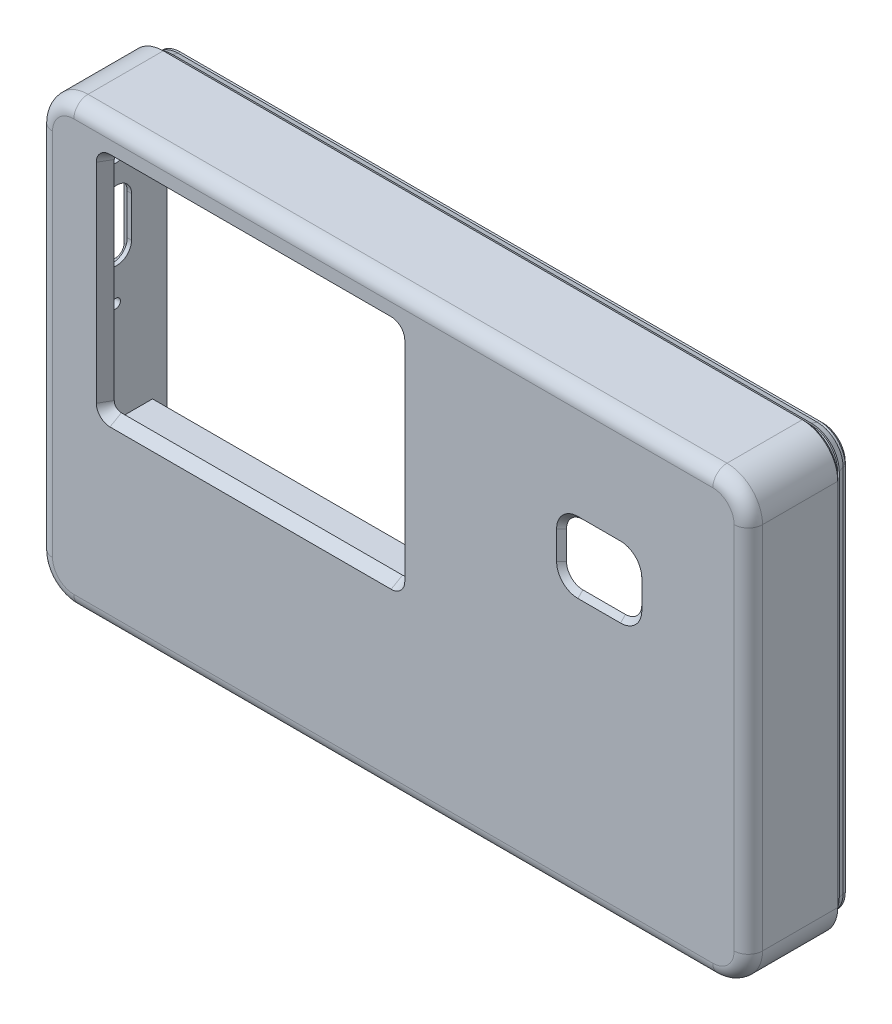
from build123d import *

# Parameters (mm, degrees)
BODY_DEPTH              = 13
ROUND_FRONT_R           = 2
CAVITY_DEPTH            = 11.4
LIP_START               = -2.5
LIP_DEPTH               = 2.5
LIP_CHAMFER_SIZE        = 0.5
BEAD_DEPTH              = 0.8
BEAD_DRAFT              = -17.354024636
SCREEN_WINDOW_DEPTH     = 1.9
SCREEN_WINDOW_DRAFT     = -30
BOARD_FENCE_SK6_W       = 1.2
BOARD_FENCE_SK6_H       = 31.02
BOARD_FENCE_SK6_W_2     = 42.22
BOARD_FENCE_SK6_H_2     = 1.2
BOARD_FENCE_DEPTH       = 5.9
TP_RAILS_SK7_W          = 25
TP_RAILS_SK7_H          = 1.2
TP_RAILS_DEPTH          = 1.57
TP_FENCE_SK8_W          = 24
TP_FENCE_SK8_H          = 1
TP_FENCE_SK8_W_2        = 1
TP_FENCE_SK8_H_2        = 15.3
TP_FENCE_SK8_H_3        = 1.05
TP_FENCE_DEPTH          = 3.37
CELL_RIBS_SK9_W         = 1.2
CELL_RIBS_SK9_H         = 12
CELL_RIBS_DEPTH         = 9.05
MAX_RELIEF_DEPTH        = 0.9
MAX_WINDOW_DEPTH        = 1.8
MAX_WINDOW_CHAMFER_SIZE = 1
MAX_LEDGES_SK12_W       = 1.6
MAX_LEDGES_SK12_H       = 1.6
MAX_LEDGES_DEPTH        = 1.3
MAX_FENCE_DEPTH         = 2.6
USB_RECESS_DEPTH        = 2
LEFT_PORTS_SK15_R       = 1.8
LEFT_PORTS_SK15_R_2     = 0.65
LEFT_PORTS_DEPTH        = 3.2
BUZZER_KEEPER_SK16_W    = 1.2
BUZZER_KEEPER_SK16_H    = 8
BUZZER_KEEPER_DEPTH     = 14.8
MIC_KEEPER_SK17_W       = 6
MIC_KEEPER_SK17_H       = 1.2
MIC_KEEPER_DEPTH        = 13.5
SEAM_SHADOW_SIZE        = 0.4
PRY_NOTCH_SK18_W        = 8
PRY_NOTCH_SK18_H        = 1.8
PRY_NOTCH_DEPTH         = 1.2


with BuildPart() as part:
    # Body_Sk1 → Body (new body)
    with BuildSketch(Plane.XY):
        with BuildLine():
            Line((-45, -31), (45, -31))
            ThreePointArc((45, -31), (48.535533906, -29.535533906), (50, -26))
            Line((50, -26), (50, 26))
            ThreePointArc((50, 26), (48.535533906, 29.535533906), (45, 31))
            Line((45, 31), (-45, 31))
            ThreePointArc((-45, 31), (-48.535533906, 29.535533906), (-50, 26))
            Line((-50, 26), (-50, -26))
            ThreePointArc((-50, -26), (-48.535533906, -29.535533906), (-45, -31))
        make_face()
    extrude(amount=-BODY_DEPTH)

    # Round_Front
    round_front_edges = [part.edges().sort_by_distance(p)[0] for p in [
        (50, 0, 0),
        (48.535533906, -29.535533906, 0),
        (0, -31, 0),
        (-48.535533906, -29.535533906, 0),
        (-50, 0, 0),
        (-48.535533906, 29.535533906, 0),
        (0, 31, 0),
        (48.535533906, 29.535533906, 0),
    ]]
    fillet(round_front_edges, radius=ROUND_FRONT_R)

    # Cavity_Sk2 → Cavity (cut)
    with BuildSketch(Plane.XY.offset(-13)):
        with BuildLine():
            Line((-45, -28.4), (45, -28.4))
            ThreePointArc((45, -28.4), (46.697056275, -27.697056275), (47.4, -26))
            Line((47.4, -26), (47.4, 26))
            ThreePointArc((47.4, 26), (46.697056275, 27.697056275), (45, 28.4))
            Line((45, 28.4), (-45, 28.4))
            ThreePointArc((-45, 28.4), (-46.697056275, 27.697056275), (-47.4, 26))
            Line((-47.4, 26), (-47.4, -26))
            ThreePointArc((-47.4, -26), (-46.697056275, -27.697056275), (-45, -28.4))
        make_face()
    extrude(amount=CAVITY_DEPTH, mode=Mode.SUBTRACT)

    # Lip_Sk3 → Lip (add)
    with BuildSketch(Plane.XY.offset(-13).offset(LIP_START)):
        with BuildLine():
            Line((-45, -29.66), (45, -29.66))
            ThreePointArc((45, -29.66), (47.588010819, -28.588010819), (48.66, -26))
            Line((48.66, -26), (48.66, 26))
            ThreePointArc((48.66, 26), (47.588010819, 28.588010819), (45, 29.66))
            Line((45, 29.66), (-45, 29.66))
            ThreePointArc((-45, 29.66), (-47.588010819, 28.588010819), (-48.66, 26))
            Line((-48.66, 26), (-48.66, -26))
            ThreePointArc((-48.66, -26), (-47.588010819, -28.588010819), (-45, -29.66))
        make_face()
        with BuildLine():
            Line((-45, -28.4), (45, -28.4))
            ThreePointArc((45, -28.4), (46.697056275, -27.697056275), (47.4, -26))
            Line((47.4, -26), (47.4, 26))
            ThreePointArc((47.4, 26), (46.697056275, 27.697056275), (45, 28.4))
            Line((45, 28.4), (-45, 28.4))
            ThreePointArc((-45, 28.4), (-46.697056275, 27.697056275), (-47.4, 26))
            Line((-47.4, 26), (-47.4, -26))
            ThreePointArc((-47.4, -26), (-46.697056275, -27.697056275), (-45, -28.4))
        make_face(mode=Mode.SUBTRACT)
    extrude(amount=LIP_DEPTH)

    # Lip_Chamfer
    lip_chamfer_edges = [part.edges().sort_by_distance(p)[0] for p in [
        (-47.588010819, -28.588010819, -15.5),
        (-48.66, 0, -15.5),
        (-47.588010819, 28.588010819, -15.5),
        (0, 29.66, -15.5),
        (47.588010819, 28.588010819, -15.5),
        (48.66, 0, -15.5),
        (47.588010819, -28.588010819, -15.5),
        (0, -29.66, -15.5),
    ]]
    chamfer(lip_chamfer_edges, length=LIP_CHAMFER_SIZE)


with BuildPart() as bead_tool:
    # Bead_Sk4 → Bead (with draft: the straight prism first)
    with BuildSketch(Plane.XY.offset(-13.9)):
        with BuildLine():
            Line((-45, -29.91), (45, -29.91))
            ThreePointArc((45, -29.91), (47.764787514, -28.764787514), (48.91, -26))
            Line((48.91, -26), (48.91, 26))
            ThreePointArc((48.91, 26), (47.764787514, 28.764787514), (45, 29.91))
            Line((45, 29.91), (-45, 29.91))
            ThreePointArc((-45, 29.91), (-47.764787514, 28.764787514), (-48.91, 26))
            Line((-48.91, 26), (-48.91, -26))
            ThreePointArc((-48.91, -26), (-47.764787514, -28.764787514), (-45, -29.91))
        make_face()
        with BuildLine():
            Line((-45, -29.06), (45, -29.06))
            ThreePointArc((45, -29.06), (47.16374675, -28.16374675), (48.06, -26))
            Line((48.06, -26), (48.06, 26))
            ThreePointArc((48.06, 26), (47.16374675, 28.16374675), (45, 29.06))
            Line((45, 29.06), (-45, 29.06))
            ThreePointArc((-45, 29.06), (-47.16374675, 28.16374675), (-48.06, 26))
            Line((-48.06, 26), (-48.06, -26))
            ThreePointArc((-48.06, -26), (-47.16374675, -28.16374675), (-45, -29.06))
        make_face(mode=Mode.SUBTRACT)
    extrude(amount=-BEAD_DEPTH)
    # Bead: the draft: its side faces are tilted about the plane it starts from
    bead_sides = [bead_tool.faces().sort_by_distance(p)[0] for p in [
        (0, -29.91, -14.3),
        (47.764787514, -28.764787514, -14.3),
        (48.91, 0, -14.3),
        (47.764787514, 28.764787514, -14.3),
        (0, 29.91, -14.3),
        (-47.764787514, 28.764787514, -14.3),
        (-48.91, 0, -14.3),
        (-47.764787514, -28.764787514, -14.3),
        (-47.16374675, -28.16374675, -14.3),
        (-48.06, 0, -14.3),
        (-47.16374675, 28.16374675, -14.3),
        (0, 29.06, -14.3),
        (47.16374675, 28.16374675, -14.3),
        (48.06, 0, -14.3),
        (47.16374675, -28.16374675, -14.3),
        (0, -29.06, -14.3),
    ]]
    draft(bead_sides, Plane.XY.offset(-13.9), BEAD_DRAFT)


with BuildPart() as part_1:
    add(part.part)

    # Bead: add bead_tool
    add(bead_tool.part)


with BuildPart() as screen_window_tool:
    # Screen_Window_Sk5 → Screen_Window (with draft: the straight prism first)
    with BuildSketch(Plane.XY):
        with BuildLine():
            Line((-39.91, -6.033760431), (-0.31, -6.033760431))
            ThreePointArc((-0.31, -6.033760431), (1.050304046, -5.470304046), (1.613760431, -4.11))
            Line((1.613760431, -4.11), (1.613760431, 25.29))
            ThreePointArc((1.613760431, 25.29), (1.050304046, 26.650304046), (-0.31, 27.213760431))
            Line((-0.31, 27.213760431), (-39.91, 27.213760431))
            ThreePointArc((-39.91, 27.213760431), (-41.270304046, 26.650304046), (-41.833760431, 25.29))
            Line((-41.833760431, 25.29), (-41.833760431, -4.11))
            ThreePointArc((-41.833760431, -4.11), (-41.270304046, -5.470304046), (-39.91, -6.033760431))
        make_face()
    extrude(amount=-SCREEN_WINDOW_DEPTH)
    # Screen_Window: the draft: its side faces are tilted about the plane it starts from
    screen_window_sides = [screen_window_tool.faces().sort_by_distance(p)[0] for p in [
        (-20.11, -6.033760431, -0.95),
        (1.050304046, -5.470304046, -0.95),
        (1.613760431, 10.59, -0.95),
        (1.050304046, 26.650304046, -0.95),
        (-20.11, 27.213760431, -0.95),
        (-41.270304046, 26.650304046, -0.95),
        (-41.833760431, 10.59, -0.95),
        (-41.270304046, -5.470304046, -0.95),
    ]]
    draft(screen_window_sides, Plane.XY, SCREEN_WINDOW_DRAFT)


with BuildPart() as part_2:
    add(part_1.part)

    # Screen_Window: cut by screen_window_tool
    add(screen_window_tool.part, mode=Mode.SUBTRACT)

    # Board_Fence_Sk6 → Board_Fence (add)
    with BuildSketch(Plane.XY.offset(-1.6)):
        with Locations((3.1, 11.59)):
            Rectangle(BOARD_FENCE_SK6_W, BOARD_FENCE_SK6_H)
        with Locations((-20.31, -7.72)):
            Rectangle(BOARD_FENCE_SK6_W_2, BOARD_FENCE_SK6_H_2)
    extrude(amount=-BOARD_FENCE_DEPTH)

    # TP_Rails_Sk7 → TP_Rails (add)
    with BuildSketch(Plane.XY.offset(-1.6)):
        with Locations((-33.2, -26.2)):
            Rectangle(TP_RAILS_SK7_W, TP_RAILS_SK7_H)
        with Locations((-33.2, -10.9)):
            Rectangle(TP_RAILS_SK7_W, TP_RAILS_SK7_H)
    extrude(amount=-TP_RAILS_DEPTH)

    # TP_Fence_Sk8 → TP_Fence (add)
    with BuildSketch(Plane.XY.offset(-1.6)):
        with Locations((-31.2, -9.25)):
            Rectangle(TP_FENCE_SK8_W, TP_FENCE_SK8_H)
        with Locations((-18.4, -18.55)):
            Rectangle(TP_FENCE_SK8_W_2, TP_FENCE_SK8_H_2)
        with Locations((-31.2, -27.875)):
            Rectangle(TP_FENCE_SK8_W, TP_FENCE_SK8_H_3)
    extrude(amount=-TP_FENCE_DEPTH)

    # Cell_Ribs_Sk9 → Cell_Ribs (add)
    with BuildSketch(Plane.XY.offset(-1.6)):
        with Locations((-10, -18.05)):
            Rectangle(CELL_RIBS_SK9_W, CELL_RIBS_SK9_H)
        with Locations((8, -18.05)):
            Rectangle(CELL_RIBS_SK9_W, CELL_RIBS_SK9_H)
        with Locations((22, -18.05)):
            Rectangle(CELL_RIBS_SK9_W, CELL_RIBS_SK9_H)
    extrude(amount=-CELL_RIBS_DEPTH)

    # MAX_Relief_Sk10 → MAX_Relief (cut)
    with BuildSketch(Plane.XY.offset(-1.6)):
        with BuildLine():
            Line((20.35, 3.85), (37.65, 3.85))
            ThreePointArc((37.65, 3.85), (38.357106781, 4.142893219), (38.65, 4.85))
            Line((38.65, 4.85), (38.65, 17.15))
            ThreePointArc((38.65, 17.15), (38.357106781, 17.857106781), (37.65, 18.15))
            Line((37.65, 18.15), (20.35, 18.15))
            ThreePointArc((20.35, 18.15), (19.642893219, 17.857106781), (19.35, 17.15))
            Line((19.35, 17.15), (19.35, 4.85))
            ThreePointArc((19.35, 4.85), (19.642893219, 4.142893219), (20.35, 3.85))
        make_face()
    extrude(amount=MAX_RELIEF_DEPTH, mode=Mode.SUBTRACT)

    # MAX_Window_Sk11 → MAX_Window (cut)
    with BuildSketch(Plane.XY):
        with BuildLine():
            Line((26, 7), (32, 7))
            ThreePointArc((32, 7), (33.414213562, 7.585786438), (34, 9))
            Line((34, 9), (34, 13))
            ThreePointArc((34, 13), (33.414213562, 14.414213562), (32, 15))
            Line((32, 15), (26, 15))
            ThreePointArc((26, 15), (24.585786438, 14.414213562), (24, 13))
            Line((24, 13), (24, 9))
            ThreePointArc((24, 9), (24.585786438, 7.585786438), (26, 7))
        make_face()
    extrude(amount=-MAX_WINDOW_DEPTH, mode=Mode.SUBTRACT)

    # MAX_Window_Chamfer
    # the kernel refuses this chamfer: 1 mm, written as the material it takes off along each edge
    with BuildSketch(Plane(origin=(26, 9, 0), x_dir=(-1, 0, 0), z_dir=(0, 1, 0))) as max_window_chamfer_piece_1:
        Polygon((2 + MAX_WINDOW_CHAMFER_SIZE, 0), (2, -MAX_WINDOW_CHAMFER_SIZE), (2, 0), align=None)
    revolve(axis=Axis((26, 9, 0), (0, 0, 1)), revolution_arc=90, mode=Mode.SUBTRACT)
    with BuildSketch(Plane(origin=(26, 7, 0), x_dir=(0, -0.9996219169112968, 0.027495876610586365), z_dir=(1, 0, 0)), Plane(origin=(32, 15, 0), x_dir=(0, 0.9996219169112968, 0.02749587661058639), z_dir=(-1, 0, 0))) as max_window_chamfer_piece_2:
        Polygon((MAX_WINDOW_CHAMFER_SIZE * 0.999621916911, MAX_WINDOW_CHAMFER_SIZE * 0.0274958766106), (-MAX_WINDOW_CHAMFER_SIZE * 0.0274958766106, MAX_WINDOW_CHAMFER_SIZE * 0.999621916911), (0, 0), align=None)
    extrude(amount=6, mode=Mode.SUBTRACT)
    with BuildSketch(Plane(origin=(32, 9, 0), x_dir=(0, -1, 0), z_dir=(-1, 0, 0))) as max_window_chamfer_piece_3:
        Polygon((2 + MAX_WINDOW_CHAMFER_SIZE, 0), (2, -MAX_WINDOW_CHAMFER_SIZE), (2, 0), align=None)
    revolve(axis=Axis((32, 9, 0), (0, 0, 1)), revolution_arc=90, mode=Mode.SUBTRACT)
    with BuildSketch(Plane(origin=(34, 9, 0), x_dir=(0.9996219169112968, 0, 0.027495876610586292), z_dir=(0, 1, 0)), Plane(origin=(24, 13, 0), x_dir=(-0.9996219169112968, 0, 0.02749587661058639), z_dir=(0, -1, 0))) as max_window_chamfer_piece_4:
        Polygon((MAX_WINDOW_CHAMFER_SIZE * 0.999621916911, MAX_WINDOW_CHAMFER_SIZE * 0.0274958766106), (-MAX_WINDOW_CHAMFER_SIZE * 0.0274958766106, MAX_WINDOW_CHAMFER_SIZE * 0.999621916911), (0, 0), align=None)
    extrude(amount=4, mode=Mode.SUBTRACT)
    with BuildSketch(Plane(origin=(32, 13, 0), x_dir=(1, 0, 0), z_dir=(0, -1, 0))) as max_window_chamfer_piece_5:
        Polygon((2 + MAX_WINDOW_CHAMFER_SIZE, 0), (2, -MAX_WINDOW_CHAMFER_SIZE), (2, 0), align=None)
    revolve(axis=Axis((32, 13, 0), (0, 0, 1)), revolution_arc=90, mode=Mode.SUBTRACT)
    with BuildSketch(Plane(origin=(26, 13, 0), x_dir=(0, 1, 0), z_dir=(1, 0, 0))) as max_window_chamfer_piece_6:
        Polygon((2 + MAX_WINDOW_CHAMFER_SIZE, 0), (2, -MAX_WINDOW_CHAMFER_SIZE), (2, 0), align=None)
    revolve(axis=Axis((26, 13, 0), (0, 0, 1)), revolution_arc=90, mode=Mode.SUBTRACT)

    # MAX_Ledges_Sk12 → MAX_Ledges (add)
    with BuildSketch(Plane.XY.offset(-0.7)):
        with Locations((19.45, 3.95)):
            Rectangle(MAX_LEDGES_SK12_W, MAX_LEDGES_SK12_H)
        with Locations((19.45, 18.05)):
            Rectangle(MAX_LEDGES_SK12_W, MAX_LEDGES_SK12_H)
        with Locations((38.55, 3.95)):
            Rectangle(MAX_LEDGES_SK12_W, MAX_LEDGES_SK12_H)
        with Locations((38.55, 18.05)):
            Rectangle(MAX_LEDGES_SK12_W, MAX_LEDGES_SK12_H)
    extrude(amount=-MAX_LEDGES_DEPTH)

    # MAX_Fence_Sk13 → MAX_Fence (add)
    with BuildSketch(Plane.XY.offset(-1.6)):
        Polygon((17.45, 20.05), (37.35, 20.05), (37.35, 18.85), (18.65, 18.85), (18.65, 3.15), (37.35, 3.15), (37.35, 1.95), (17.45, 1.95), align=None)
    extrude(amount=-MAX_FENCE_DEPTH)

    # USB_Recess_Sk14 → USB_Recess (cut)
    with BuildSketch(Plane(origin=(-50, 0, 0), x_dir=(0, 0, -1), z_dir=(1, 0, 0))):
        with BuildLine():
            Line((12.07, 5.29), (12.07, 15.89))
            ThreePointArc((12.07, 15.89), (11.718528137, 16.738528137), (10.87, 17.09))
            Line((10.87, 17.09), (6.07, 17.09))
            ThreePointArc((6.07, 17.09), (5.221471863, 16.738528137), (4.87, 15.89))
            Line((4.87, 15.89), (4.87, 5.29))
            ThreePointArc((4.87, 5.29), (5.221471863, 4.441471863), (6.07, 4.09))
            Line((6.07, 4.09), (10.87, 4.09))
            ThreePointArc((10.87, 4.09), (11.718528137, 4.441471863), (12.07, 5.29))
        make_face()
        with BuildLine():
            Line((9.6, -23.85), (9.6, -13.25))
            ThreePointArc((9.6, -13.25), (9.248528137, -12.401471863), (8.4, -12.05))
            Line((8.4, -12.05), (3.6, -12.05))
            ThreePointArc((3.6, -12.05), (2.751471863, -12.401471863), (2.4, -13.25))
            Line((2.4, -13.25), (2.4, -23.85))
            ThreePointArc((2.4, -23.85), (2.751471863, -24.698528137), (3.6, -25.05))
            Line((3.6, -25.05), (8.4, -25.05))
            ThreePointArc((8.4, -25.05), (9.248528137, -24.698528137), (9.6, -23.85))
        make_face()
    extrude(amount=USB_RECESS_DEPTH, mode=Mode.SUBTRACT)

    # Left_Ports_Sk15 → Left_Ports (cut)
    with BuildSketch(Plane(origin=(-50, 0, 0), x_dir=(0, 0, -1), z_dir=(1, 0, 0))):
        with Locations((8.305, 20.04)):
            Circle(LEFT_PORTS_SK15_R)
        with Locations((8.305, 1.115)):
            Circle(LEFT_PORTS_SK15_R_2)
        with BuildLine():
            Line((6.42, 7.74), (6.42, 13.44))
            ThreePointArc((6.42, 13.44), (8.47, 15.49), (10.52, 13.44))
            Line((10.52, 13.44), (10.52, 7.74))
            ThreePointArc((10.52, 7.74), (8.47, 5.69), (6.42, 7.74))
        make_face()
        with BuildLine():
            Line((3.75, -21.2), (3.75, -15.9))
            ThreePointArc((3.75, -15.9), (6, -13.65), (8.25, -15.9))
            Line((8.25, -15.9), (8.25, -21.2))
            ThreePointArc((8.25, -21.2), (6, -23.45), (3.75, -21.2))
        make_face()
    extrude(amount=LEFT_PORTS_DEPTH, mode=Mode.SUBTRACT)

    # Buzzer_Keeper_Sk16 → Buzzer_Keeper (add)
    with BuildSketch(Plane.XY.offset(-1.6)):
        with Locations((44.9, -18)):
            Rectangle(BUZZER_KEEPER_SK16_W, BUZZER_KEEPER_SK16_H)
    extrude(amount=-BUZZER_KEEPER_DEPTH)

    # Mic_Keeper_Sk17 → Mic_Keeper (add)
    with BuildSketch(Plane.XY.offset(-1.6)):
        with Locations((16, 27.8)):
            Rectangle(MIC_KEEPER_SK17_W, MIC_KEEPER_SK17_H)
    extrude(amount=-MIC_KEEPER_DEPTH)

    # Seam_Shadow
    seam_shadow_edges = [part_2.edges().sort_by_distance(p)[0] for p in [
        (48.535533906, -29.535533906, -13),
        (50, 0, -13),
        (48.535533906, 29.535533906, -13),
        (0, 31, -13),
        (-48.535533906, 29.535533906, -13),
        (-50, 0, -13),
        (-48.535533906, -29.535533906, -13),
        (0, -31, -13),
    ]]
    chamfer(seam_shadow_edges, length=SEAM_SHADOW_SIZE)

    # Pry_Notch_Sk18 → Pry_Notch (cut)
    with BuildSketch(Plane(origin=(0, -31, 0), x_dir=(1, 0, 0), z_dir=(0, 1, 0))):
        with Locations((38, 12.1)):
            Rectangle(PRY_NOTCH_SK18_W, PRY_NOTCH_SK18_H)
    extrude(amount=PRY_NOTCH_DEPTH, mode=Mode.SUBTRACT)


solid = part_2.part
